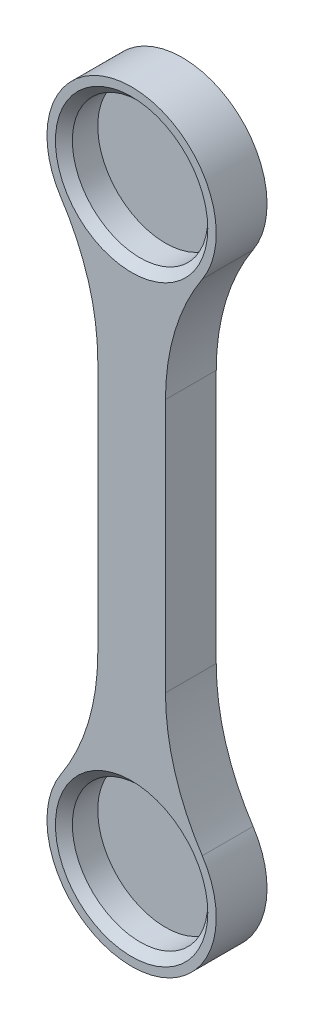
from build123d import *
from build123d.topology import SkipClean

# Parameters (mm, degrees)
BOSS_EXTRU_1_DEPTH      = 6
ESQUISSE2_R             = 8
ENL_V_MAT_EXTRU_1_DEPTH = 4
ENL_V_MAT_EXTRU_2_DEPTH = 81.845531726
CHANFREIN1_SIZE         = 1


with BuildPart() as part:
    # Esquisse1 → Boss.-Extru.1 (new body)
    with BuildSketch(Plane.XY):
        with BuildLine():
            Line((-10, 0), (-10, 70))
            ThreePointArc((-10, 70), (0, 80), (10, 70))
            Line((10, 70), (10, 0))
            ThreePointArc((10, 0), (0, -10), (-10, 0))
        make_face()
    extrude(amount=BOSS_EXTRU_1_DEPTH)

    # Esquisse2 → Enlèv. mat.-Extru.1 (cut)
    with BuildSketch(Plane.XY.offset(6)):
        Circle(ESQUISSE2_R)
        with Locations((0, 70)):
            Circle(ESQUISSE2_R)
    extrude(amount=-ENL_V_MAT_EXTRU_1_DEPTH, mode=Mode.SUBTRACT)

    # Esquisse3 → Enlèv. mat.-Extru.2 (cut, through all)
    with SkipClean():  # the faces are left unmerged after this step: merging them gives an invalid solid
        with BuildSketch(Plane.XY.offset(6)):
            with BuildLine():
                Line((-4, 50), (-4, 20))
                ThreePointArc((-4, 20), (-5.110574489, 12.433172347), (-8.348623853, 5.504587156))
                ThreePointArc((-8.348623853, 5.504587156), (-9.578262852, 2.873478856), (-10, 0))
                Line((-10, 0), (-10, 70))
                ThreePointArc((-10, 70), (-9.578262852, 67.126521144), (-8.348623853, 64.495412844))
                ThreePointArc((-8.348623853, 64.495412844), (-5.110574489, 57.566827653), (-4, 50))
            make_face()
            with BuildLine():
                Line((4, 50), (4, 20))
                ThreePointArc((4, 20), (5.110574489, 12.433172347), (8.348623853, 5.504587156))
                ThreePointArc((8.348623853, 5.504587156), (9.578262852, 2.873478856), (10, 0))
                Line((10, 0), (10, 70))
                ThreePointArc((10, 70), (9.578262852, 67.126521144), (8.348623853, 64.495412844))
                ThreePointArc((8.348623853, 64.495412844), (5.110574489, 57.566827653), (4, 50))
            make_face()
        extrude(amount=-ENL_V_MAT_EXTRU_2_DEPTH, mode=Mode.SUBTRACT)

    # Chanfrein1
    chanfrein1_edges = [part.edges().sort_by_distance(p)[0] for p in [
        (-8, 0, 6),
        (-8, 70, 6),
    ]]
    chamfer(chanfrein1_edges, length=CHANFREIN1_SIZE)


solid = part.part
